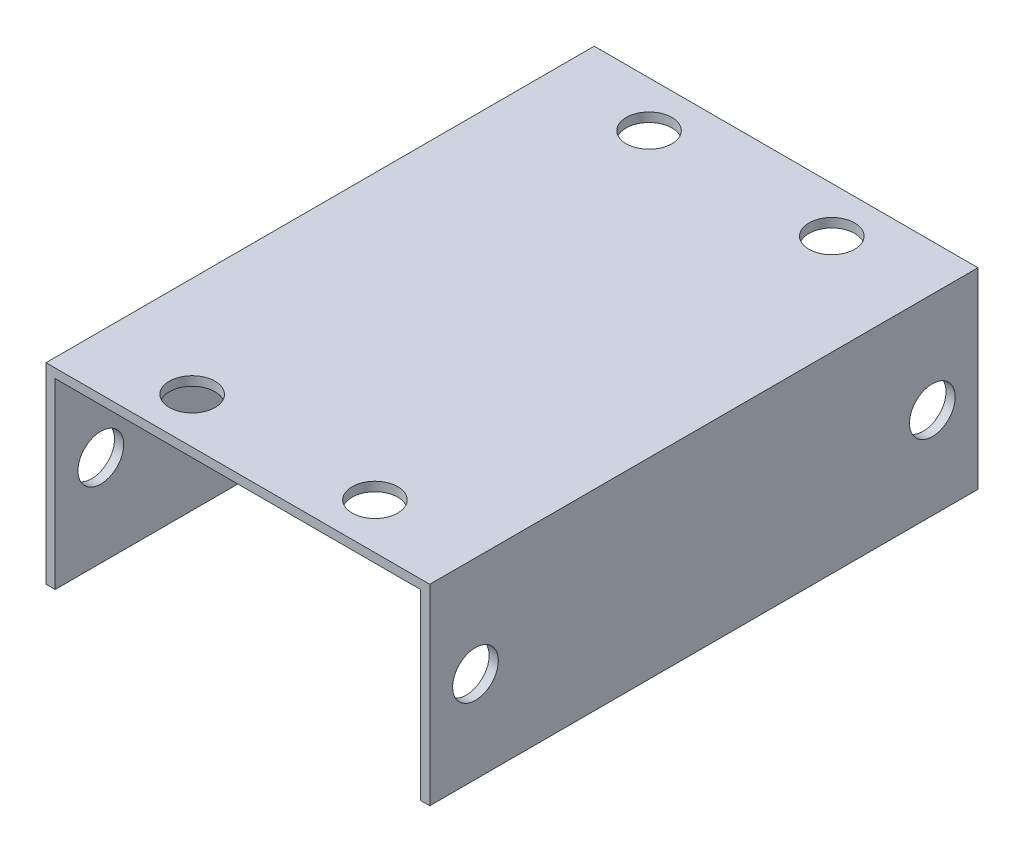
from build123d import *

# Parameters (mm, degrees)
BOSS_EXTRUDE1_DEPTH     = 60
SKETCH2_R               = 2.5
CUT_EXTRUDE1_DEPTH      = 67.640828326
CUT_EXTRUDE2_DEPTH      = 74.4982993
CUT_EXTRUDE2_DEPTH_BACK = 74.4982993
SKETCH3_R               = 2.5


with BuildPart() as part:
    # Sketch1 → Boss-Extrude1 (new body)
    with BuildSketch(Plane.XY):
        Polygon((-20, -10), (-20, 10), (20, 10), (20, -10), (21, -10), (21, 11), (-21, 11), (-21, -10), align=None)
    extrude(amount=BOSS_EXTRUDE1_DEPTH)

    # Sketch2 → Cut-Extrude1 (cut, through all)
    with BuildSketch(Plane.XZ.offset(-10)):
        with Locations((-10, 5)):
            Circle(SKETCH2_R)
        with Locations((10, 5)):
            Circle(SKETCH2_R)
        with Locations((10, 55)):
            Circle(SKETCH2_R)
        with Locations((-10, 55)):
            Circle(SKETCH2_R)
    extrude(amount=-CUT_EXTRUDE1_DEPTH, mode=Mode.SUBTRACT)

    # Sketch3 → Cut-Extrude2 (cut, two sides: drawn at the far end of the back side and taken through both)
    with BuildSketch(Plane.ZY.offset(-20).offset(-CUT_EXTRUDE2_DEPTH_BACK)):
        with Locations((5, 0)):
            Circle(SKETCH3_R)
        with Locations((55, 0)):
            Circle(SKETCH3_R)
    extrude(amount=CUT_EXTRUDE2_DEPTH + CUT_EXTRUDE2_DEPTH_BACK, mode=Mode.SUBTRACT)


solid = part.part
